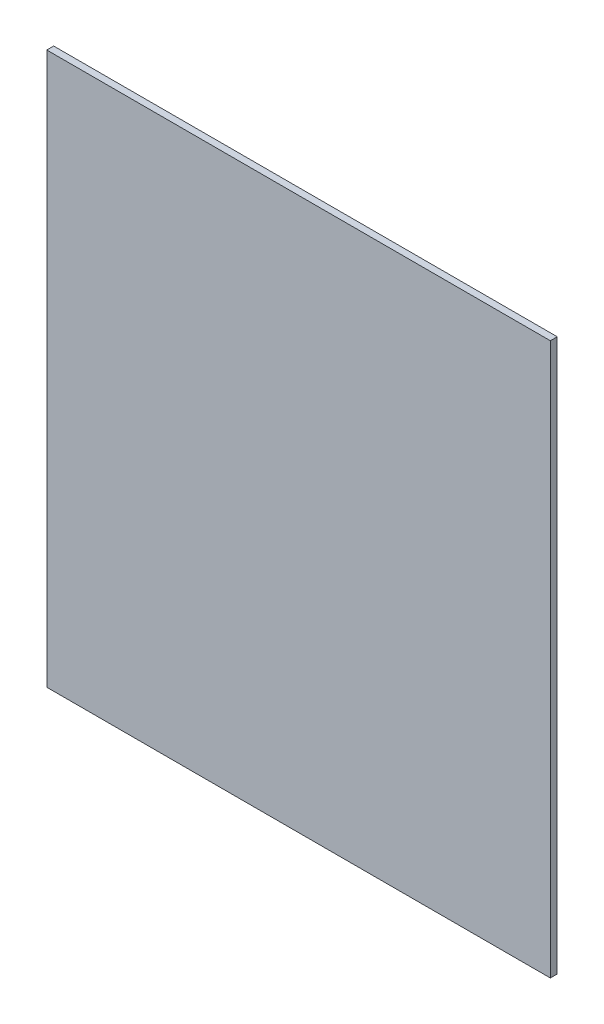
from build123d import *

# Parameters (mm, degrees)
SKETCH1_W           = 146
SKETCH1_H           = 160
BOSS_EXTRUDE1_DEPTH = 2


with BuildPart() as part:
    # Sketch1 → Boss-Extrude1 (new body)
    with BuildSketch(Plane.XY):
        Rectangle(SKETCH1_W, SKETCH1_H)
    extrude(amount=BOSS_EXTRUDE1_DEPTH)


solid = part.part
